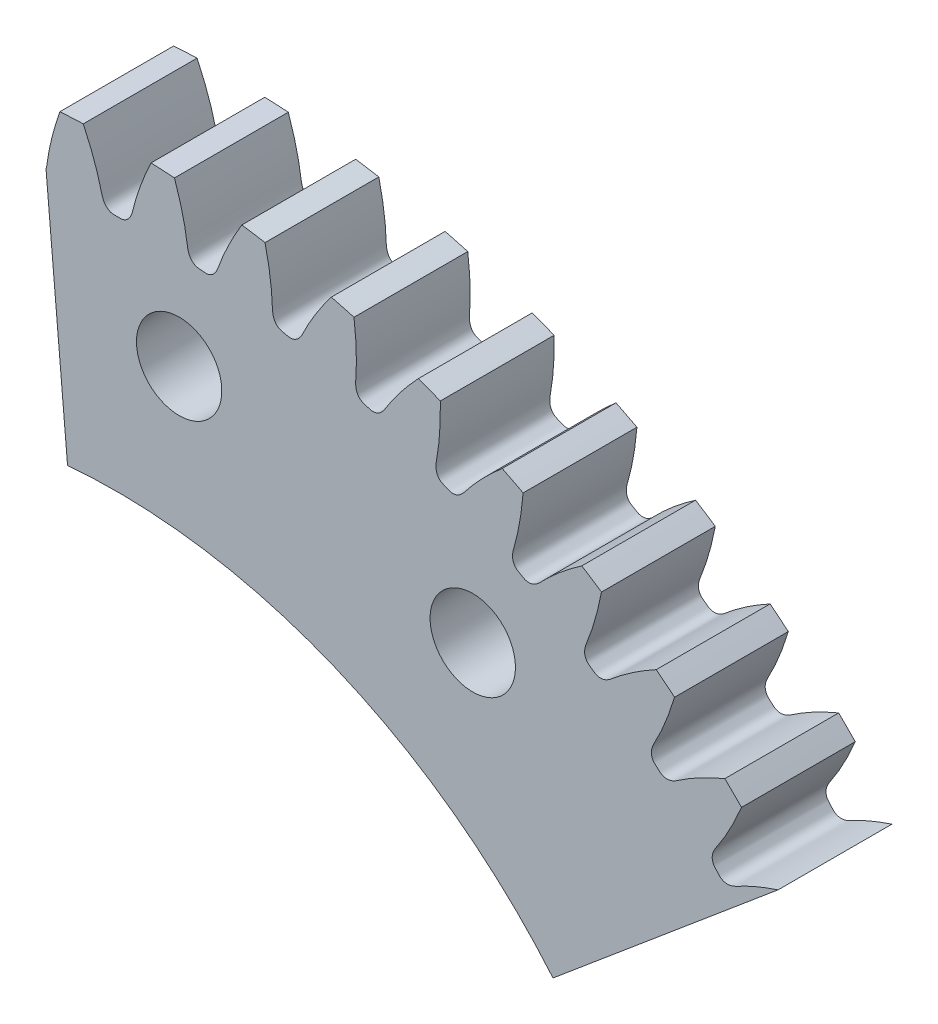
from build123d import *

# Parameters (mm, degrees)
SKETCHREVOLVESPURASSEMBLY02GEAR_W       = 4
SKETCHREVOLVESPURASSEMBLY02GEAR_H       = 30.625
TOOTHEXTRUDECUTSPURASSEMBLY02GEAR_DEPTH = 9.525
PATTERNSPURASSEMBLY02GEAR_COUNT         = 60
SKETCH_1_R                              = 1.5
CUT_EXTRUDE_1_DEPTH                     = 44.462037332


with BuildPart() as part:
    # SketchRevolveSpurAssembly02Gear → SpurAssembly02Gear (revolve)
    with BuildSketch(Plane(origin=(0, 0, 0), x_dir=(0, 0, -1), z_dir=(1, 0, 0))):
        with Locations((-7.525, 15.3125)):
            Rectangle(SKETCHREVOLVESPURASSEMBLY02GEAR_W, SKETCHREVOLVESPURASSEMBLY02GEAR_H)
    revolve(axis=Axis((0, 0, 0), (0, 0, -1)))

    # SketchToothSpurAssembly02Gear → ToothExtrudeCutSpurAssembly02Gear (cut, symmetric)
    with BuildSketch(Plane.XY):
        with BuildLine():
            ThreePointArc((30.63257431, 1.204597517), (30.65625, 0), (30.63257431, -1.204597517))
            add(Edge.make_bspline(
                [(30.63257431, -1.204597517), (30.543938775, -1.162534343), (30.412244395, -1.101993385), (30.237877264, -1.025849803), (30.112568261, -0.972996887), (29.990742021, -0.923409439), (29.872460243, -0.876991158), (29.757782757, -0.833644661), (29.646767473, -0.793271682), (29.53947049, -0.755772613), (29.43594564, -0.721048238), (29.336246028, -0.688993811), (29.240418563, -0.65951993), (29.148523018, -0.632479762), (29.060565558, -0.607922721), (28.940935812, -0.575518182), (28.841502395, -0.553857585), (28.763844893, -0.531531424), (28.740731948, -0.524283498), (28.718069953, -0.516592167), (28.695821823, -0.508402875), (28.673940921, -0.499666029), (28.652377269, -0.49031405), (28.63107629, -0.480263314), (28.60998027, -0.469408524), (28.589030349, -0.457617975), (28.568170374, -0.444727435), (28.547353357, -0.430533459), (28.52655191, -0.414786644), (28.505774313, -0.397186358), (28.485088051, -0.377379843), (28.464652044, -0.354970672), (28.444756656, -0.329544159), (28.425865175, -0.30071886), (28.408642877, -0.268232328), (28.393945234, -0.232055542), (28.382751117, -0.192523846), (28.376336026, -0.152665348), (28.373340609, -0.088181956), (28.376253815, 0), (28.373340609, 0.088181956), (28.376336026, 0.152665348), (28.382751117, 0.192523846), (28.393945234, 0.232055542), (28.408642877, 0.268232328), (28.425865175, 0.30071886), (28.444756656, 0.329544159), (28.464652044, 0.354970672), (28.485088051, 0.377379843), (28.505774313, 0.397186358), (28.52655191, 0.414786644), (28.547353357, 0.430533459), (28.568170374, 0.444727435), (28.589030349, 0.457617975), (28.60998027, 0.469408524), (28.63107629, 0.480263314), (28.652377269, 0.49031405), (28.673940921, 0.499666029), (28.695821823, 0.508402875), (28.718069953, 0.516592167), (28.740731948, 0.524283498), (28.763844893, 0.531531424), (28.841502395, 0.553857585), (28.940935812, 0.575518182), (29.060565558, 0.607922721), (29.148523018, 0.632479762), (29.240418563, 0.65951993), (29.336246028, 0.688993811), (29.43594564, 0.721048238), (29.53947049, 0.755772613), (29.646767473, 0.793271682), (29.757782757, 0.833644661), (29.872460243, 0.876991158), (29.990742021, 0.923409439), (30.112568261, 0.972996887), (30.237877264, 1.025849803), (30.412244395, 1.101993385), (30.543938775, 1.162534343), (30.63257431, 1.204597517)],
                knots=[0, 0, 0, 0, 0.054136997, 0.079972903, 0.104987081, 0.129179531, 0.152550253, 0.175099248, 0.196826514, 0.217732051, 0.237815861, 0.257077943, 0.275518297, 0.293136923, 0.30993382, 0.32590899, 0.361524169, 0.366040277, 0.370491752, 0.374889101, 0.379244487, 0.383572039, 0.387888205, 0.39221217, 0.39656633, 0.400976817, 0.405474045, 0.41009321, 0.414874643, 0.41986379, 0.425110506, 0.430667139, 0.436584759, 0.442906824, 0.44965994, 0.456842382, 0.464412936, 0.472284658, 0.479058624, 0.5, 0.520941376, 0.527715342, 0.535587064, 0.543157618, 0.55034006, 0.557093176, 0.563415241, 0.569332861, 0.574889494, 0.58013621, 0.585125357, 0.58990679, 0.594525955, 0.599023183, 0.60343367, 0.60778783, 0.612111795, 0.616427961, 0.620755513, 0.625110899, 0.629508248, 0.633959723, 0.638475831, 0.67409101, 0.69006618, 0.706863077, 0.724481703, 0.742922057, 0.762184139, 0.782267949, 0.803173486, 0.824900752, 0.847449747, 0.870820469, 0.895012919, 0.920027097, 0.945863003, 1, 1, 1, 1], degree=3))
        make_face()
    toothextrudecutspurassembly02gear = extrude(amount=TOOTHEXTRUDECUTSPURASSEMBLY02GEAR_DEPTH, both=True, mode=Mode.SUBTRACT)

    # PatternSpurAssembly02Gear: ToothExtrudeCutSpurAssembly02Gear ×60 about axis
    patternspurassembly02gear_axis = Axis((0, 0, 50), (0, 0, -1))
    for i in range(1, PATTERNSPURASSEMBLY02GEAR_COUNT):
        add(toothextrudecutspurassembly02gear.rotate(patternspurassembly02gear_axis, i * 360 / PATTERNSPURASSEMBLY02GEAR_COUNT), mode=Mode.SUBTRACT)

    # Эскиз1 → Вырез-Вытянуть1 (cut, through all)
    with BuildSketch(Plane(origin=(0, 0, 5.525), x_dir=(-1, 0, 0), z_dir=(0, 0, -1))):
        with Locations((-2.178893569, 24.904867452)):
            Circle(SKETCH_1_R)
        with Locations((-12.5, 21.650635095)):
            Circle(SKETCH_1_R)
        with BuildLine():
            Line((-15.320888862, 12.855752194), (-26.811555509, 22.497566339))
            ThreePointArc((-26.811555509, 22.497566339), (13.393920133, -32.335783638), (3.050450996, 34.866814433))
            Line((3.050450996, 34.866814433), (1.743114855, 19.923893962))
            ThreePointArc((1.743114855, 19.923893962), (-7.653668647, 18.47759065), (-15.320888862, 12.855752194))
        make_face()
    extrude(amount=-CUT_EXTRUDE_1_DEPTH, mode=Mode.SUBTRACT)


solid = part.part
